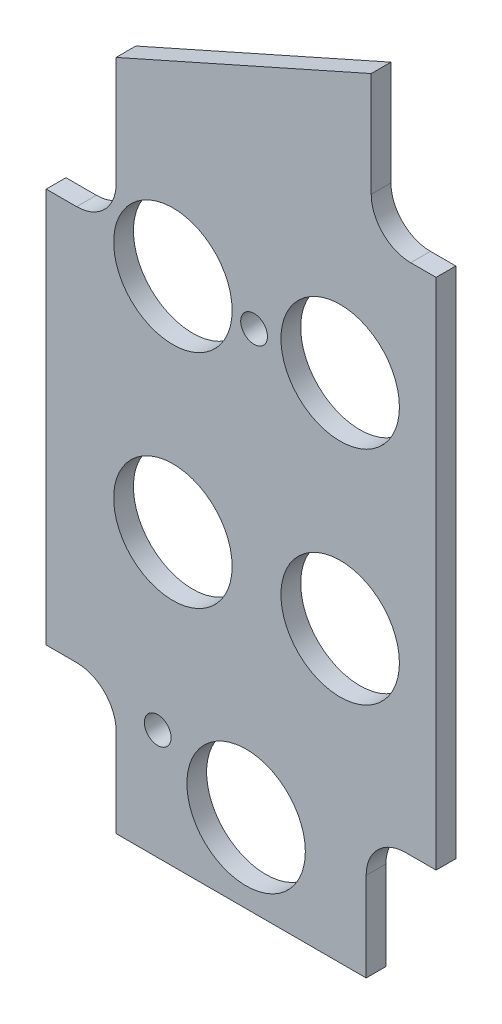
from build123d import *

# Parameters (mm, degrees)
BOSS_EXTRUDE1_DEPTH   = 3.175
SKETCH2_R             = 9.525
CUT_EXTRUDE1_DEPTH    = 146.261713697
F_6_CLEARANCE_HOLE1_D = 4.3053
CUT_EXTRUDE2_DEPTH    = 146.261713697
F_6_CLEARANCE_HOLE2_D = 4.3053


with BuildPart() as part:
    # Sketch1 → Boss-Extrude1 (new body)
    with BuildSketch(Plane.XY):
        Polygon((0, 103.090949096), (0, 0), (62.688793586, 0), (62.688793586, 131), align=None)
    extrude(amount=-BOSS_EXTRUDE1_DEPTH)

    # Sketch2 → Cut-Extrude1 (cut, through all)
    with BuildSketch(Plane.XY):
        with Locations((32.143907641, 12.7)):
            Circle(SKETCH2_R)
        with Locations((47.270490427, 46.548006151)):
            Circle(SKETCH2_R)
        with Locations((47.270490427, 82.18542385)):
            Circle(SKETCH2_R)
        with Locations((20.373235059, 82.18542385)):
            Circle(SKETCH2_R)
        with Locations((20.373235059, 46.548006151)):
            Circle(SKETCH2_R)
    extrude(amount=-CUT_EXTRUDE1_DEPTH, mode=Mode.SUBTRACT)

    # #6 Clearance Hole1 (through all)
    with Locations(Plane.XY):
        with Locations((58.6105, 14.2875), (4.8895, 14.2875), (4.8895, 90.4875), (58.6105, 109.5375)):
            Hole(F_6_CLEARANCE_HOLE1_D / 2)

    # Sketch5 → Cut-Extrude2 (cut, through all)
    with BuildSketch(Plane.XY):
        with BuildLine():
            Line((0, 0), (11.24, 0))
            Line((11.24, 0), (11.24, 14.29))
            ThreePointArc((11.24, 14.29), (9.380128061, 18.780128061), (4.89, 20.64))
            Line((4.89, 20.64), (0, 20.64))
            Line((0, 20.64), (0, 0))
        make_face()
        with BuildLine():
            Line((51.448793586, 14.29), (51.448793586, 0))
            Line((51.448793586, 0), (62.688793586, 0))
            Line((62.688793586, 0), (62.688793586, 20.64))
            Line((62.688793586, 20.64), (57.798793586, 20.64))
            ThreePointArc((57.798793586, 20.64), (53.308665525, 18.780128061), (51.448793586, 14.29))
        make_face()
        with BuildLine():
            Line((0, 103.090949096), (0, 84.1375))
            Line((0, 84.1375), (4.8895, 84.1375))
            ThreePointArc((4.8895, 84.1375), (9.379628061, 85.997371939), (11.2395, 90.4875))
            Line((11.2395, 90.4875), (11.2395, 108.094774496))
            Line((11.2395, 108.094774496), (0, 103.090949096))
        make_face()
        with BuildLine():
            Line((62.688793586, 131), (62.688793586, 103.1875))
            Line((62.688793586, 103.1875), (58.6105, 103.1875))
            ThreePointArc((58.6105, 103.1875), (54.120371939, 105.047371939), (52.2605, 109.5375))
            Line((52.2605, 109.5375), (52.2605, 126.357323696))
            Line((52.2605, 126.357323696), (62.688793586, 131))
        make_face()
    extrude(amount=-CUT_EXTRUDE2_DEPTH, mode=Mode.SUBTRACT)

    # #6 Clearance Hole2 (through all)
    with Locations(Plane(origin=(31.750004441, 0, 1.59), x_dir=(1, 0, 0), z_dir=(0, 0, 1))):
        with Locations((1.676331213, 81.383391323), (-13.818696068, 17.771227958)):
            Hole(F_6_CLEARANCE_HOLE2_D / 2)


solid = part.part
